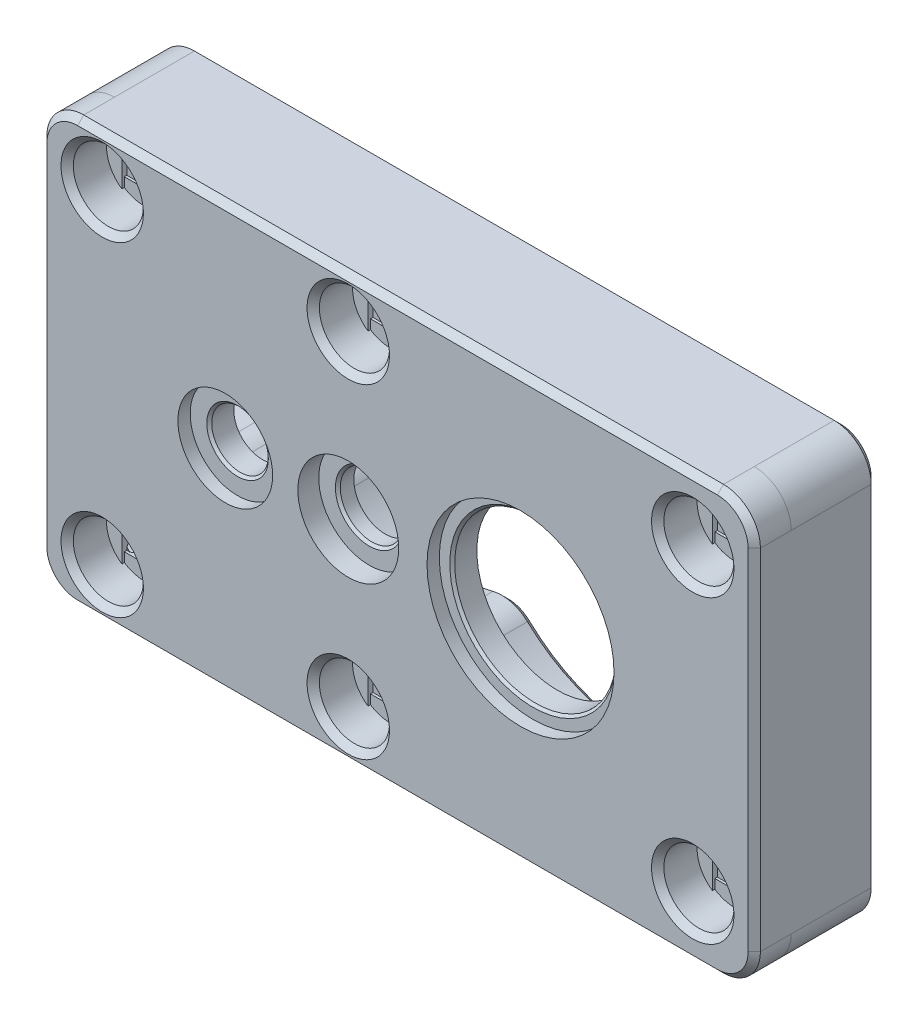
from build123d import *

# Parameters (mm, degrees)
BOSS_EXTRUDE1_DEPTH  = 7
BOSS_EXTRUDE2_DEPTH  = 3
SKETCH4_R            = 2.3
SKETCH4_R_2          = 2.550000000000001
SKETCH4_R_3          = 6.550000000000002
CUT_EXTRUDE1_DEPTH   = 48.37974250668739
SKETCH5_R            = 3.85
CUT_EXTRUDE2_DEPTH   = 1
SKETCH6_R            = 4.1000000000000005
CUT_EXTRUDE3_DEPTH   = 1.7
SKETCH7_R            = 7.6000000000000005
CUT_EXTRUDE4_DEPTH   = 1
FILLET1_R            = 3
CHAMFER1_SIZE        = 0.2
FILLET2_R            = 1
SKETCH8_R            = 1.6000000000000019
SKETCH8_R_2          = 1.6
CUT_EXTRUDE5_DEPTH   = 48.37974252779346
SKETCH9_R            = 2.85
CUT_EXTRUDE6_DEPTH   = 3.2
CUT_EXTRUDE7_START   = -0.2
SKETCH11_R           = 1.6
CUT_EXTRUDE7_DEPTH   = 0.2
SKETCH12_W           = 3.2000000000000046
SKETCH12_H           = 3.1999999999999993
CUT_EXTRUDE8_DEPTH   = 0.2
SKETCH15_R           = 1.5999999999999979
CUT_EXTRUDE9_DEPTH   = 48.37974252779346
CUT_EXTRUDE10_DEPTH  = 3.1
FILLET3_R            = 1
FILLET3_OF_MIRROR1_R = 1
CHAMFER2_SIZE        = 0.5


with BuildPart() as part:
    # Sketch1 → Boss-Extrude1 (new body)
    with BuildSketch(Plane.XY):
        with BuildLine():
            Line((-15, 5.999999999999998), (-15, 14.200000000000005))
            ThreePointArc((-15, 14.200000000000005), (-14.121320343559638, 16.321320343559645), (-12, 17.2))
            Line((-12, 17.2), (40, 17.199999999999992))
            ThreePointArc((40, 17.199999999999992), (42.121320343559645, 16.321320343559634), (43, 14.19999999999999))
            Line((43, 14.19999999999999), (43, -14.199999999999994))
            ThreePointArc((43, -14.199999999999994), (42.12132034355964, -16.321320343559634), (40, -17.199999999999992))
            Line((40, -17.199999999999992), (-12.000000000000004, -17.2))
            ThreePointArc((-12.000000000000004, -17.2), (-14.121320343559644, -16.32132034355964), (-15, -14.200000000000001))
            Line((-15, -14.200000000000001), (-15, -6))
            ThreePointArc((-15, -6), (-14.121320343559642, -3.878679656440357), (-12, -2.9999999999999996))
            Line((-12, -2.9999999999999996), (-3.605551275463993, -2.9999999999999982))
            ThreePointArc((-3.605551275463993, -2.9999999999999982), (-2.803767549726719, -3.1091276650217052), (-2.060315014550853, -3.428571428571429))
            ThreePointArc((-2.060315014550853, -3.428571428571429), (-1.000033178407501, -3.8729747794278495), (0.14285714285714599, -3.997448165609493))
            ThreePointArc((0.14285714285714599, -3.997448165609493), (1.5720317156342603, -4.302537419625869), (2.687500000000003, -5.24665071736246))
            ThreePointArc((2.687500000000003, -5.24665071736246), (6.931902414879214, -8.460896950570664), (12.25, -8.714212528966685))
            ThreePointArc((12.25, -8.714212528966685), (13.750000000000002, -8.714212528966684), (15.062500000000004, -9.440396906380576))
            ThreePointArc((15.062500000000004, -9.440396906380576), (36.99999999999999, 0), (15.062500000000002, 9.440396906380574))
            ThreePointArc((15.062500000000002, 9.440396906380574), (13.75, 8.714212528966684), (12.25, 8.714212528966685))
            ThreePointArc((12.25, 8.714212528966685), (6.931902414879218, 8.460896950570666), (2.687500000000004, 5.246650717362461))
            ThreePointArc((2.687500000000004, 5.246650717362461), (1.5720317156342611, 4.302537419625867), (0.14285714285714596, 3.997448165609493))
            ThreePointArc((0.14285714285714596, 3.997448165609493), (-1.000033178407501, 3.8729747794278495), (-2.060315014550853, 3.428571428571429))
            ThreePointArc((-2.060315014550853, 3.428571428571429), (-2.8037675497267185, 3.109127665021704), (-3.605551275463993, 2.9999999999999982))
            Line((-3.605551275463993, 2.9999999999999982), (-12, 2.9999999999999996))
            ThreePointArc((-12, 2.9999999999999996), (-14.121320343559642, 3.878679656440356), (-15, 5.999999999999998))
        make_face()
    extrude(amount=BOSS_EXTRUDE1_DEPTH)

    # Sketch2 → Boss-Extrude2 (add)
    with BuildSketch(Plane.XY.offset(7.000000000000002)):
        Polygon((-15, 17.2), (43, 17.2), (43, -17.199999999999992), (-14.999999999999996, -17.199999999999992), align=None)
    extrude(amount=BOSS_EXTRUDE2_DEPTH)

    # Sketch4 → Cut-Extrude1 (cut, through all)
    with BuildSketch(Plane.XY.offset(10.000000000000002)):
        Circle(SKETCH4_R)
        with Locations((10, 0)):
            Circle(SKETCH4_R_2)
        with Locations((24, 0)):
            Circle(SKETCH4_R_3)
    extrude(amount=-CUT_EXTRUDE1_DEPTH, mode=Mode.SUBTRACT)

    # Sketch5 → Cut-Extrude2 (cut)
    with BuildSketch(Plane.XY.offset(10.000000000000002)):
        Circle(SKETCH5_R)
    extrude(amount=-CUT_EXTRUDE2_DEPTH, mode=Mode.SUBTRACT)

    # Sketch6 → Cut-Extrude3 (cut)
    with BuildSketch(Plane.XY.offset(10.000000000000002)):
        with Locations((10.000000000000002, 0)):
            Circle(SKETCH6_R)
    extrude(amount=-CUT_EXTRUDE3_DEPTH, mode=Mode.SUBTRACT)

    # Sketch7 → Cut-Extrude4 (cut)
    with BuildSketch(Plane.XY.offset(10.000000000000002)):
        with Locations((24, 0)):
            Circle(SKETCH7_R)
    extrude(amount=-CUT_EXTRUDE4_DEPTH, mode=Mode.SUBTRACT)

    # Fillet1
    fillet1_edges = [part.edges().sort_by_distance(p)[0] for p in [
        (43, -17.199999999999992, 8.500000000000002),
        (-14.999999999999996, -17.199999999999992, 8.500000000000002),
        (-15, 17.2, 8.500000000000002),
        (43, 17.2, 8.500000000000002),
    ]]
    fillet(fillet1_edges, radius=FILLET1_R)

    # Chamfer1
    chamfer1_edges = [part.edges().sort_by_distance(p)[0] for p in [
        (-2.3, 2.8e-16, 9.000000000000002),
        (7.449999999999999, -8.2e-16, 8.300000000000002),
        (17.45, 8e-16, 9.000000000000002),
    ]]
    chamfer(chamfer1_edges, length=CHAMFER1_SIZE)

    # Fillet2
    fillet2_edges = [part.edges().sort_by_distance(p)[0] for p in [
        (13.75, 8.714212528966684, 7),
        (6.931902414879217, 8.460896950570664, 7),
        (1.5720317156342616, 4.302537419625867, 7),
        (-1.0000331784075014, 3.8729747794278495, 7),
        (-2.803767549726719, 3.1091276650217043, 7),
        (-7.802775637731997, 2.999999999999999, 7),
        (-14.121320343559642, 3.878679656440356, 7),
        (-14.121320343559642, -3.878679656440358, 7),
        (-7.802775637731997, -2.999999999999999, 7),
        (-2.8037675497267194, -3.1091276650217052, 7),
        (-1.0000331784075012, -3.8729747794278495, 7),
        (1.5720317156342603, -4.302537419625869, 7),
        (6.931902414879216, -8.460896950570664, 7),
        (13.750000000000002, -8.714212528966684, 7),
        (36.99999999999999, 1.377e-14, 7),
    ]]
    fillet(fillet2_edges, radius=FILLET2_R)

    # Sketch8 → Cut-Extrude5 (cut, through all)
    with BuildSketch(Plane(origin=(0, 0, 0), x_dir=(-1, 0, 0), z_dir=(0, 0, -1))):
        with Locations((-9.999999999999996, -13.199999999999994)):
            Circle(SKETCH8_R)
        with Locations((10.000000000000004, -13.199999999999994)):
            Circle(SKETCH8_R_2)
        with Locations((-9.999999999999996, 13.200000000000005)):
            Circle(SKETCH8_R_2)
        with Locations((10.000000000000004, 13.200000000000005)):
            Circle(SKETCH8_R_2)
    extrude(amount=-CUT_EXTRUDE5_DEPTH, mode=Mode.SUBTRACT)

    # Sketch9 → Cut-Extrude6 (cut)
    with BuildSketch(Plane.XY.offset(10.000000000000002)):
        with Locations((-10.000000000000004, 13.200000000000005)):
            Circle(SKETCH9_R)
    cut_extrude6 = extrude(amount=-CUT_EXTRUDE6_DEPTH, mode=Mode.SUBTRACT)

    # Sketch11 → Cut-Extrude7 (cut)
    with BuildSketch(Plane.XY.offset(6.8000000000000025).offset(CUT_EXTRUDE7_START)):
        with BuildLine():
            ThreePointArc((-8.400000000000002, 15.558495283014155), (-10.000000000000004, 16.050000000000004), (-11.600000000000005, 15.558495283014155))
            Line((-11.600000000000005, 15.558495283014155), (-11.600000000000005, 13.200000000000003))
            ThreePointArc((-11.600000000000003, 13.200000000000005), (-10.000000000000004, 14.800000000000004), (-8.400000000000004, 13.200000000000005))
            Line((-8.400000000000002, 13.200000000000005), (-8.400000000000002, 15.558495283014155))
        make_face()
        with BuildLine():
            ThreePointArc((-8.400000000000004, 13.200000000000005), (-10.000000000000004, 11.600000000000005), (-11.600000000000003, 13.200000000000005))
            Line((-11.600000000000005, 13.200000000000003), (-11.600000000000005, 10.841504716985854))
            ThreePointArc((-11.600000000000007, 10.841504716985856), (-10.000000000000004, 10.350000000000005), (-8.400000000000004, 10.841504716985854))
            Line((-8.400000000000002, 10.841504716985854), (-8.400000000000002, 13.200000000000005))
        make_face()
        with Locations(Location((-10.000000000000004, 13.200000000000005, 0), (0, 0, 180))):
            Circle(SKETCH11_R)
    cut_extrude7 = extrude(amount=CUT_EXTRUDE7_DEPTH, mode=Mode.SUBTRACT)

    # Sketch12 → Cut-Extrude8 (cut)
    with BuildSketch(Plane.XY.offset(6.600000000000002)):
        with Locations((-10.000000000000004, 13.200000000000006)):
            Rectangle(SKETCH12_W, SKETCH12_H)
    cut_extrude8 = extrude(amount=-CUT_EXTRUDE8_DEPTH, mode=Mode.SUBTRACT)

    # Sketch-Pattern1: Cut-Extrude6, Cut-Extrude7, Cut-Extrude8 at 3 more places
    with Locations((20, 0, 0), (20, -26.4, 0), (0, -26.4, 0)):
        add(cut_extrude6, mode=Mode.SUBTRACT)
        add(cut_extrude7, mode=Mode.SUBTRACT)
        add(cut_extrude8, mode=Mode.SUBTRACT)

    # Sketch15 → Cut-Extrude9 (cut, through all)
    with BuildSketch(Plane.XY.offset(10.000000000000002)):
        with Locations((38.00000000000001, 12.199999999999992)):
            Circle(SKETCH15_R)
        with Locations((38.00000000000001, -12.199999999999992)):
            Circle(SKETCH15_R)
    extrude(amount=-CUT_EXTRUDE9_DEPTH, mode=Mode.SUBTRACT)

    # Sketch-Pattern3: Cut-Extrude6, Cut-Extrude7, Cut-Extrude8 at 2 more places
    with Locations((48, -1, 0), (48, -25.4, 0)):
        add(cut_extrude6, mode=Mode.SUBTRACT)
        add(cut_extrude7, mode=Mode.SUBTRACT)
        add(cut_extrude8, mode=Mode.SUBTRACT)

    # Sketch16 → Cut-Extrude10 (cut)
    with BuildSketch(Plane(origin=(0, 0, 0), x_dir=(-1, 0, 0), z_dir=(0, 0, -1))):
        with BuildLine():
            Line((3.9999999999999925, -7.6000000000000005), (2.4142135623731473, -7.6000000000000005))
            ThreePointArc((2.4142135623731473, -7.6000000000000005), (1.9932617867715514, -7.683732514237584), (1.6363961030679497, -7.922182540694794))
            Line((1.6363961030679497, -7.922182540694794), (-1.3636038969320825, -10.922182540694791))
            ThreePointArc((-1.3636038969320825, -10.922182540694791), (-1.6020539233893005, -12.120951775601595), (-0.5857864376268844, -12.799999999999999))
            Line((-0.5857864376268844, -12.799999999999999), (3.9999999999999933, -12.799999999999999))
            ThreePointArc((3.9999999999999933, -12.799999999999999), (4.7778174593052, -12.477817459305202), (5.099999999999999, -11.699999999999994))
            Line((5.099999999999999, -11.699999999999994), (5.1, -8.700000000000008))
            ThreePointArc((5.1, -8.700000000000008), (4.777817459305202, -7.9221825406947985), (3.9999999999999925, -7.6000000000000005))
        make_face()
    cut_extrude10 = extrude(amount=-CUT_EXTRUDE10_DEPTH, mode=Mode.SUBTRACT)

    # Fillet3
    fillet3_edges = [part.edges().sort_by_distance(p)[0] for p in [
        (-4.777817459305202, -7.9221825406947985, 3.1),
        (-5.1, -10.200000000000001, 3.1),
        (-4.777817459305201, -12.4778174593052, 3.1),
        (-1.7071067811865543, -12.799999999999999, 3.1),
        (1.602053923389301, -12.120951775601595, 3.1),
        (-0.1363961030679337, -9.422182540694793, 3.1),
        (-1.9932617867715514, -7.683732514237584, 3.1),
        (-3.20710678118657, -7.6000000000000005, 3.1),
        (-4.777817459305202, -7.9221825406947985, 0),
        (-3.20710678118657, -7.6000000000000005, 0),
        (-1.9932617867715514, -7.683732514237584, 0),
        (-0.1363961030679337, -9.422182540694793, 0),
        (1.602053923389301, -12.120951775601595, 0),
        (-1.7071067811865543, -12.799999999999999, 0),
        (-4.777817459305201, -12.4778174593052, 0),
        (-5.1, -10.200000000000001, 0),
    ]]
    fillet(fillet3_edges, radius=FILLET3_R)

    # Mirror1: Cut-Extrude10 across plane
    add(cut_extrude10.mirror(Plane.ZX), mode=Mode.SUBTRACT)

    # Fillet3 of Mirror1
    fillet3_of_mirror1_edges = [part.edges().sort_by_distance(p)[0] for p in [
        (-4.777817459305202, 7.9221825406947985, 3.1),
        (-5.1, 10.200000000000001, 3.1),
        (-4.777817459305201, 12.4778174593052, 3.1),
        (-1.7071067811865543, 12.799999999999999, 3.1),
        (1.602053923389301, 12.120951775601595, 3.1),
        (-0.1363961030679337, 9.422182540694793, 3.1),
        (-1.9932617867715514, 7.683732514237584, 3.1),
        (-3.20710678118657, 7.6000000000000005, 3.1),
        (-4.777817459305202, 7.9221825406947985, 0),
        (-3.20710678118657, 7.6000000000000005, 0),
        (-1.9932617867715514, 7.683732514237584, 0),
        (-0.1363961030679337, 9.422182540694793, 0),
        (1.602053923389301, 12.120951775601595, 0),
        (-1.7071067811865543, 12.799999999999999, 0),
        (-4.777817459305201, 12.4778174593052, 0),
        (-5.1, 10.200000000000001, 0),
    ]]
    fillet(fillet3_of_mirror1_edges, radius=FILLET3_OF_MIRROR1_R)

    # Chamfer2
    # the kernel refuses this chamfer: 0.5 mm, written as the material it takes off along each edge
    with BuildSketch(Plane(origin=(43, 14.2, 10.000000000000002), x_dir=(0.0274958766105822, 0, -0.999621916911297), z_dir=(0, -1, 0))) as chamfer2_piece_1:
        Polygon((CHAMFER2_SIZE * 0.999621916911, -CHAMFER2_SIZE * 0.0274958766106), (-CHAMFER2_SIZE * 0.0274958766106, -CHAMFER2_SIZE * 0.999621916911), (0, 0), align=None)
    extrude(amount=28.39999999999999, mode=Mode.SUBTRACT)
    with BuildSketch(Plane(origin=(40, -17.199999999999992, 10.000000000000002), x_dir=(0, -0.0274958766105891, -0.9996219169112968), z_dir=(-1, 0, 0)), Plane(origin=(-12.000000000000002, 17.2, 10.000000000000002), x_dir=(0, 0.0274958766105891, -0.9996219169112968), z_dir=(1, 0, 0))) as chamfer2_piece_2:
        Polygon((CHAMFER2_SIZE * 0.999621916911, -CHAMFER2_SIZE * 0.0274958766106), (-CHAMFER2_SIZE * 0.0274958766106, -CHAMFER2_SIZE * 0.999621916911), (0, 0), align=None)
    extrude(amount=52, mode=Mode.SUBTRACT)
    with BuildSketch(Plane(origin=(-14.999999999999996, -14.199999999999992, 10.000000000000002), x_dir=(-0.027495876610585647, 0, -0.9996219169112968), z_dir=(-1e-16, 1, 0))) as chamfer2_piece_3:
        Polygon((CHAMFER2_SIZE * 0.999621916911, -CHAMFER2_SIZE * 0.0274958766106), (-CHAMFER2_SIZE * 0.0274958766106, -CHAMFER2_SIZE * 0.999621916911), (0, 0), align=None)
    extrude(amount=28.39999999999999, mode=Mode.SUBTRACT)
    with BuildSketch(Plane(origin=(40, 14.2, 10.000000000000002), x_dir=(0, 1, 0), z_dir=(-1, 0, 0))) as chamfer2_piece_4:
        Polygon((3 - CHAMFER2_SIZE, 0), (3, CHAMFER2_SIZE), (3, 0), align=None)
    revolve(axis=Axis((40, 14.2, 10.000000000000002), (0, 0, -1)), revolution_arc=90, mode=Mode.SUBTRACT)
    with BuildSketch(Plane(origin=(-12, 14.2, 10.000000000000002), x_dir=(0, 1, 0), z_dir=(1, 0, 0))) as chamfer2_piece_5:
        Polygon((3 - CHAMFER2_SIZE, 0), (3, -CHAMFER2_SIZE), (3, 0), align=None)
    revolve(axis=Axis((-12, 14.2, 10.000000000000002), (0, 0, 1)), revolution_arc=90, mode=Mode.SUBTRACT)
    with BuildSketch(Plane(origin=(-11.999999999999998, -14.199999999999992, 10.000000000000002), x_dir=(-1, 0, 0), z_dir=(0, 1, 0))) as chamfer2_piece_6:
        Polygon((3, -CHAMFER2_SIZE), (3 - CHAMFER2_SIZE, 0), (3, 0), align=None)
    revolve(axis=Axis((-11.999999999999998, -14.199999999999992, 10.000000000000002), (0, 0, 1)), revolution_arc=90, mode=Mode.SUBTRACT)
    with BuildSketch(Plane(origin=(40, -14.199999999999992, 10.000000000000002), x_dir=(1, 0, 0), z_dir=(0, 1, 0))) as chamfer2_piece_7:
        Polygon((3 - CHAMFER2_SIZE, 0), (3, CHAMFER2_SIZE), (3, 0), align=None)
    revolve(axis=Axis((40, -14.199999999999992, 10.000000000000002), (0, 0, -1)), revolution_arc=90, mode=Mode.SUBTRACT)
    with BuildSketch(Plane(origin=(-3.605551275463993, 5.999999999999994, 0), x_dir=(0.5150787536377142, -0.8571428571428564, 0), z_dir=(0.8571428571428564, 0.5150787536377142, 0))) as chamfer2_piece_8:
        Polygon((2.9999999999999956 - CHAMFER2_SIZE, 0), (2.9999999999999956, -CHAMFER2_SIZE), (2.9999999999999956, 0), align=None)
    revolve(axis=Axis((-3.605551275463993, 5.999999999999994, 0), (0, 0, -1)), revolution_arc=31.00271913387408, mode=Mode.SUBTRACT)
    with BuildSketch(Plane(origin=(-3.605551275463993, 2.9999999999999982, 0), x_dir=(0, 0.9996219169112968, -0.027495876610586365), z_dir=(-1, 1.6e-16, 0)), Plane(origin=(-12, -2.9999999999999996, 0), x_dir=(0, -0.9996219169112968, -0.027495876610586365), z_dir=(1, 1.6e-16, 0))) as chamfer2_piece_9:
        Polygon((CHAMFER2_SIZE * 0.999621916911, -CHAMFER2_SIZE * 0.0274958766106), (-CHAMFER2_SIZE * 0.0274958766106, -CHAMFER2_SIZE * 0.999621916911), (0, 0), align=None)
    extrude(amount=8.394448724536007, mode=Mode.SUBTRACT)
    with BuildSketch(Plane(origin=(-10.000000000000004, -13.199999999999994, 0), x_dir=(-1, 0, 0), z_dir=(0, -1, 0))) as chamfer2_piece_10:
        Polygon((1.5999999999999996 + CHAMFER2_SIZE, 0), (1.5999999999999996, -CHAMFER2_SIZE), (1.5999999999999996, 0), align=None)
    revolve(axis=Axis((-10.000000000000004, -13.199999999999994, 0), (0, 0, -1)), mode=Mode.SUBTRACT)
    with BuildSketch(Plane(origin=(-12, 5.999999999999998, 0), x_dir=(0, -1, 0), z_dir=(1, 0, 0))) as chamfer2_piece_11:
        Polygon((2.9999999999999996 - CHAMFER2_SIZE, 0), (2.9999999999999996, -CHAMFER2_SIZE), (2.9999999999999996, 0), align=None)
    revolve(axis=Axis((-12, 5.999999999999998, 0), (0, 0, -1)), revolution_arc=90, mode=Mode.SUBTRACT)
    with BuildSketch(Plane(origin=(9.999999999999996, 13.200000000000005, 0), x_dir=(-1, 0, 0), z_dir=(0, -1, 0))) as chamfer2_piece_12:
        Polygon((1.5999999999999996 + CHAMFER2_SIZE, 0), (1.5999999999999996, -CHAMFER2_SIZE), (1.5999999999999996, 0), align=None)
    revolve(axis=Axis((9.999999999999996, 13.200000000000005, 0), (0, 0, -1)), mode=Mode.SUBTRACT)
    with BuildSketch(Plane(origin=(-10.000000000000004, 13.200000000000005, 0), x_dir=(-1, 0, 0), z_dir=(0, -1, 0))) as chamfer2_piece_13:
        Polygon((1.5999999999999996 + CHAMFER2_SIZE, 0), (1.5999999999999996, -CHAMFER2_SIZE), (1.5999999999999996, 0), align=None)
    revolve(axis=Axis((-10.000000000000004, 13.200000000000005, 0), (0, 0, -1)), mode=Mode.SUBTRACT)
    with BuildSketch(Plane(origin=(9.999999999999996, -13.199999999999994, 0), x_dir=(-1, 0, 0), z_dir=(0, -1, 0))) as chamfer2_piece_14:
        Polygon((1.6000000000000014 + CHAMFER2_SIZE, 0), (1.6000000000000014, -CHAMFER2_SIZE), (1.6000000000000014, 0), align=None)
    revolve(axis=Axis((9.999999999999996, -13.199999999999994, 0), (0, 0, -1)), mode=Mode.SUBTRACT)
    with BuildSketch(Plane(origin=(-15, 5.999999999999998, 0), x_dir=(0.9996219169112968, 0, -0.02749587661058644), z_dir=(0, 1, 0))) as chamfer2_piece_15:
        Polygon((CHAMFER2_SIZE * 0.999621916911, -CHAMFER2_SIZE * 0.0274958766106), (-CHAMFER2_SIZE * 0.0274958766106, -CHAMFER2_SIZE * 0.999621916911), (0, 0), align=None)
    extrude(amount=8.200000000000006, mode=Mode.SUBTRACT)
    with BuildSketch(Plane(origin=(-11.999999999999996, 14.199999999999998, 0), x_dir=(-1, 2.37e-15, 0), z_dir=(-2.37e-15, -1, 0))) as chamfer2_piece_16:
        Polygon((3.0000000000000036 - CHAMFER2_SIZE, 0), (3.0000000000000036, -CHAMFER2_SIZE), (3.0000000000000036, 0), align=None)
    revolve(axis=Axis((-11.999999999999996, 14.199999999999998, 0), (0, 0, -1)), revolution_arc=89.9999999999998, mode=Mode.SUBTRACT)
    with BuildSketch(Plane(origin=(-10.000000000000004, 13.200000000000005, 10.000000000000002), x_dir=(1, 0, 0), z_dir=(0, -1, 0))) as chamfer2_piece_17:
        Polygon((2.8499999999999996 + CHAMFER2_SIZE, 0), (2.8499999999999996, -CHAMFER2_SIZE), (2.8499999999999996, 0), align=None)
    revolve(axis=Axis((-10.000000000000004, 13.200000000000005, 10.000000000000002), (0, 0, 1)), mode=Mode.SUBTRACT)
    with BuildSketch(Plane(origin=(-12, 17.2, 0), x_dir=(0, -0.9996219169112968, -0.027495876610586292), z_dir=(1, -1.4e-16, 0)), Plane(origin=(40, -17.199999999999992, 0), x_dir=(0, 0.9996219169112968, -0.027495876610586292), z_dir=(-1, -1.4e-16, 0))) as chamfer2_piece_18:
        Polygon((CHAMFER2_SIZE * 0.999621916911, -CHAMFER2_SIZE * 0.0274958766106), (-CHAMFER2_SIZE * 0.0274958766106, -CHAMFER2_SIZE * 0.999621916911), (0, 0), align=None)
    extrude(amount=52, mode=Mode.SUBTRACT)
    with BuildSketch(Plane(origin=(40.00000000000001, 14.199999999999996, 0), x_dir=(-2.37e-15, 1, 0), z_dir=(-1, -2.37e-15, 0))) as chamfer2_piece_19:
        Polygon((2.999999999999993 - CHAMFER2_SIZE, 0), (2.999999999999993, -CHAMFER2_SIZE), (2.999999999999993, 0), align=None)
    revolve(axis=Axis((40.00000000000001, 14.199999999999996, 0), (0, 0, -1)), revolution_arc=90.00000000000024, mode=Mode.SUBTRACT)
    with BuildSketch(Plane(origin=(43, 14.19999999999999, 0), x_dir=(-0.9996219169112968, 0, -0.027495876610586483), z_dir=(0, -1, 0))) as chamfer2_piece_20:
        Polygon((CHAMFER2_SIZE * 0.999621916911, -CHAMFER2_SIZE * 0.0274958766106), (-CHAMFER2_SIZE * 0.0274958766106, -CHAMFER2_SIZE * 0.999621916911), (0, 0), align=None)
    extrude(amount=28.399999999999984, mode=Mode.SUBTRACT)
    with BuildSketch(Plane(origin=(39.999999999999986, -14.199999999999985, 0), x_dir=(1, -2.96e-15, 0), z_dir=(2.96e-15, 1, 0))) as chamfer2_piece_21:
        Polygon((3.000000000000014 - CHAMFER2_SIZE, 0), (3.000000000000014, -CHAMFER2_SIZE), (3.000000000000014, 0), align=None)
    revolve(axis=Axis((39.999999999999986, -14.199999999999985, 0), (0, 0, -1)), revolution_arc=89.99999999999957, mode=Mode.SUBTRACT)
    with BuildSketch(Plane(origin=(-12, -14.2, 0), x_dir=(-1.18e-15, -1, 0), z_dir=(1, -1.18e-15, 0))) as chamfer2_piece_22:
        Polygon((3 - CHAMFER2_SIZE, 0), (3, -CHAMFER2_SIZE), (3, 0), align=None)
    revolve(axis=Axis((-12, -14.2, 0), (0, 0, -1)), revolution_arc=89.9999999999999, mode=Mode.SUBTRACT)
    with BuildSketch(Plane(origin=(-11.999999999999996, -6.000000000000002, 0), x_dir=(-1, 5.9e-16, 0), z_dir=(-5.9e-16, -1, 0))) as chamfer2_piece_23:
        Polygon((3.0000000000000036 - CHAMFER2_SIZE, 0), (3.0000000000000036, -CHAMFER2_SIZE), (3.0000000000000036, 0), align=None)
    revolve(axis=Axis((-11.999999999999996, -6.000000000000002, 0), (0, 0, -1)), revolution_arc=89.9999999999999, mode=Mode.SUBTRACT)
    with BuildSketch(Plane(origin=(-3.605551275464003, -6.000000000000027, 0), x_dir=(3.26e-15, 1, 0), z_dir=(-1, 3.26e-15, 0))) as chamfer2_piece_24:
        Polygon((3.0000000000000284 - CHAMFER2_SIZE, 0), (3.0000000000000284, -CHAMFER2_SIZE), (3.0000000000000284, 0), align=None)
    revolve(axis=Axis((-3.605551275464003, -6.000000000000027, 0), (0, 0, -1)), revolution_arc=31.002719133873725, mode=Mode.SUBTRACT)
    with BuildSketch(Plane(origin=(2.47e-15, 1.088e-14, 0), x_dir=(-0.5150787536377125, -0.8571428571428574, 0), z_dir=(-0.8571428571428574, 0.5150787536377125, 0))) as chamfer2_piece_25:
        Polygon((4.000000000000012 + CHAMFER2_SIZE, 0), (4.000000000000012, CHAMFER2_SIZE), (4.000000000000012, 0), align=None)
    revolve(axis=Axis((2.47e-15, 1.088e-14, 0), (0, 0, 1)), revolution_arc=33.049432231546554, mode=Mode.SUBTRACT)
    with BuildSketch(Plane(origin=(0.249999999999999, -6.99553428981662, 0), x_dir=(-0.03571428571428425, 0.9993620414023731, 0), z_dir=(-0.9993620414023731, -0.03571428571428425, 0))) as chamfer2_piece_26:
        Polygon((3.000000000000007 - CHAMFER2_SIZE, 0), (3.000000000000007, -CHAMFER2_SIZE), (3.000000000000007, 0), align=None)
    revolve(axis=Axis((0.249999999999999, -6.99553428981662, 0), (0, 0, -1)), revolution_arc=56.38762540153368, mode=Mode.SUBTRACT)
    with BuildSketch(Plane(origin=(10, 2.66e-15, 0), x_dir=(-0.8124999999999997, -0.5829611908180515, 0), z_dir=(-0.5829611908180515, 0.8124999999999997, 0))) as chamfer2_piece_27:
        Polygon((9.000000000000002 + CHAMFER2_SIZE, 0), (9.000000000000002, CHAMFER2_SIZE), (9.000000000000002, 0), align=None)
    revolve(axis=Axis((10, 2.66e-15, 0), (0, 0, 1)), revolution_arc=68.81842448979113, mode=Mode.SUBTRACT)
    with BuildSketch(Plane(origin=(-10.000000000000004, -13.199999999999994, 6.400000000000002), x_dir=(-1, 0, 0), z_dir=(0, -1, 0))) as chamfer2_piece_28_section:
        Polygon((1.5999999999999996, CHAMFER2_SIZE), (1.5999999999999996 + CHAMFER2_SIZE, 0), (1.5999999999999996, 0), align=None)
    chamfer2_piece_28 = revolve(axis=Axis((-10.000000000000004, -13.199999999999994, 6.400000000000002), (0, 0, -1)), revolution_arc=90, mode=Mode.PRIVATE)
    chamfer2_piece_28 = split(chamfer2_piece_28, bisect_by=Plane(origin=(-11.600000000000005, -12.021446695962746, 6.213135176030215), z_dir=(1, 0, 0)), keep=Keep.TOP, mode=Mode.PRIVATE)
    chamfer2_piece_28 = split(chamfer2_piece_28, bisect_by=Plane(origin=(-11.178553304037255, -11.599999999999993, 6.213135176030215), z_dir=(0, -1, 0)), keep=Keep.TOP, mode=Mode.PRIVATE)
    add(chamfer2_piece_28, mode=Mode.SUBTRACT)
    with BuildSketch(Plane(origin=(-10.000000000000004, -13.199999999999994, 6.400000000000002), x_dir=(0, 1, 0), z_dir=(-1, 0, 0))) as chamfer2_piece_29_section:
        Polygon((1.5999999999999996, CHAMFER2_SIZE), (1.5999999999999996 + CHAMFER2_SIZE, 0), (1.5999999999999996, 0), align=None)
    chamfer2_piece_29 = revolve(axis=Axis((-10.000000000000004, -13.199999999999994, 6.400000000000002), (0, 0, -1)), revolution_arc=90, mode=Mode.PRIVATE)
    chamfer2_piece_29 = split(chamfer2_piece_29, bisect_by=Plane(origin=(-8.400000000000002, -12.021446695962743, 6.213135176030216), z_dir=(-1, 0, 0)), keep=Keep.TOP, mode=Mode.PRIVATE)
    chamfer2_piece_29 = split(chamfer2_piece_29, bisect_by=Plane(origin=(-8.82144669596276, -11.599999999999993, 6.213135176030216), z_dir=(0, -1, 0)), keep=Keep.TOP, mode=Mode.PRIVATE)
    add(chamfer2_piece_29, mode=Mode.SUBTRACT)
    with BuildSketch(Plane(origin=(-10.000000000000004, -13.199999999999994, 6.400000000000002), x_dir=(1, 0, 0), z_dir=(0, 1, 0))) as chamfer2_piece_30_section:
        Polygon((1.5999999999999996, CHAMFER2_SIZE), (1.5999999999999996 + CHAMFER2_SIZE, 0), (1.5999999999999996, 0), align=None)
    chamfer2_piece_30 = revolve(axis=Axis((-10.000000000000004, -13.199999999999994, 6.400000000000002), (0, 0, -1)), revolution_arc=90, mode=Mode.PRIVATE)
    chamfer2_piece_30 = split(chamfer2_piece_30, bisect_by=Plane(origin=(-8.821446695962745, -14.799999999999994, 6.213135176030212), z_dir=(0, 1, 0)), keep=Keep.TOP, mode=Mode.PRIVATE)
    chamfer2_piece_30 = split(chamfer2_piece_30, bisect_by=Plane(origin=(-8.400000000000002, -14.378553304037236, 6.213135176030212), z_dir=(-1, 0, 0)), keep=Keep.TOP, mode=Mode.PRIVATE)
    add(chamfer2_piece_30, mode=Mode.SUBTRACT)
    with BuildSketch(Plane(origin=(-10.000000000000004, -13.199999999999994, 6.400000000000002), x_dir=(0, -1, 0), z_dir=(1, 0, 0))) as chamfer2_piece_31_section:
        Polygon((1.5999999999999996, CHAMFER2_SIZE), (1.5999999999999996 + CHAMFER2_SIZE, 0), (1.5999999999999996, 0), align=None)
    chamfer2_piece_31 = revolve(axis=Axis((-10.000000000000004, -13.199999999999994, 6.400000000000002), (0, 0, -1)), revolution_arc=90, mode=Mode.PRIVATE)
    chamfer2_piece_31 = split(chamfer2_piece_31, bisect_by=Plane(origin=(-11.600000000000005, -14.378553304037249, 6.213135176030218), z_dir=(1, 0, 0)), keep=Keep.TOP, mode=Mode.PRIVATE)
    chamfer2_piece_31 = split(chamfer2_piece_31, bisect_by=Plane(origin=(-11.178553304037255, -14.799999999999994, 6.213135176030218), z_dir=(0, 1, 0)), keep=Keep.TOP, mode=Mode.PRIVATE)
    add(chamfer2_piece_31, mode=Mode.SUBTRACT)
    with BuildSketch(Plane(origin=(13.000000000000004, -11.618950038622248, 0), x_dir=(-0.25000000000000105, 0.9682458365518539, 0), z_dir=(-0.9682458365518539, -0.25000000000000105, 0))) as chamfer2_piece_32:
        Polygon((3.0000000000000013 - CHAMFER2_SIZE, 0), (3.0000000000000013, -CHAMFER2_SIZE), (3.0000000000000013, 0), align=None)
    revolve(axis=Axis((13.000000000000004, -11.618950038622248, 0), (0, 0, -1)), revolution_arc=57.91004874371975, mode=Mode.SUBTRACT)
    with BuildSketch(Plane(origin=(24, 7.55e-15, 0), x_dir=(-0.6874999999999997, -0.7261843774138909, 0), z_dir=(-0.7261843774138909, 0.6874999999999997, 0))) as chamfer2_piece_33:
        Polygon((12.999999999999995 + CHAMFER2_SIZE, 0), (12.999999999999995, CHAMFER2_SIZE), (12.999999999999995, 0), align=None)
    revolve(axis=Axis((24, 7.55e-15, 0), (0, 0, 1)), revolution_arc=266.86507311557955, mode=Mode.SUBTRACT)
    with BuildSketch(Plane(origin=(-10.000000000000004, -13.199999999999994, 10.000000000000002), x_dir=(1, 0, 0), z_dir=(0, -1, 0))) as chamfer2_piece_34:
        Polygon((2.8499999999999996 + CHAMFER2_SIZE, 0), (2.8499999999999996, -CHAMFER2_SIZE), (2.8499999999999996, 0), align=None)
    revolve(axis=Axis((-10.000000000000004, -13.199999999999994, 10.000000000000002), (0, 0, 1)), mode=Mode.SUBTRACT)
    with BuildSketch(Plane(origin=(13.000000000000004, 11.618950038622247, 0), x_dir=(0.6874999999999996, -0.726184377413891, 0), z_dir=(0.726184377413891, 0.6874999999999996, 0))) as chamfer2_piece_35:
        Polygon((2.999999999999999 - CHAMFER2_SIZE, 0), (3.0000000000000004, -CHAMFER2_SIZE), (2.999999999999999, 0), align=None)
    revolve(axis=Axis((13.000000000000004, 11.618950038622247, 0), (0, 0, -1)), revolution_arc=57.910048743719734, mode=Mode.SUBTRACT)
    with BuildSketch(Plane(origin=(10.000000000000002, -4.88e-15, 0), x_dir=(0.24999999999999975, 0.9682458365518544, 0), z_dir=(0.9682458365518544, -0.24999999999999975, 0))) as chamfer2_piece_36:
        Polygon((9.000000000000004 + CHAMFER2_SIZE, 0), (9.000000000000004, CHAMFER2_SIZE), (9.000000000000004, 0), align=None)
    revolve(axis=Axis((10.000000000000002, -4.88e-15, 0), (0, 0, 1)), revolution_arc=68.8184244897911, mode=Mode.SUBTRACT)
    with BuildSketch(Plane(origin=(0.2500000000000092, 6.995534289816599, 0), x_dir=(0.8125000000000017, -0.5829611908180486, 0), z_dir=(0.5829611908180486, 0.8125000000000017, 0))) as chamfer2_piece_37:
        Polygon((2.9999999999999876 - CHAMFER2_SIZE, 0), (2.9999999999999876, -CHAMFER2_SIZE), (2.9999999999999876, 0), align=None)
    revolve(axis=Axis((0.2500000000000092, 6.995534289816599, 0), (0, 0, -1)), revolution_arc=56.3876254015341, mode=Mode.SUBTRACT)
    with BuildSketch(Plane(origin=(9.999999999999996, -13.199999999999994, 10.000000000000002), x_dir=(1, 0, 0), z_dir=(0, -1, 0))) as chamfer2_piece_38:
        Polygon((2.8499999999999996 + CHAMFER2_SIZE, 0), (2.8499999999999996, -CHAMFER2_SIZE), (2.8499999999999996, 0), align=None)
    revolve(axis=Axis((9.999999999999996, -13.199999999999994, 10.000000000000002), (0, 0, 1)), mode=Mode.SUBTRACT)
    with BuildSketch(Plane(origin=(-2.08e-15, 6.44e-15, 0), x_dir=(0.03571428571428706, 0.9993620414023731, 0), z_dir=(0.9993620414023731, -0.03571428571428706, 0))) as chamfer2_piece_39:
        Polygon((3.9999999999999947 + CHAMFER2_SIZE, 0), (3.9999999999999947, CHAMFER2_SIZE), (3.9999999999999947, 0), align=None)
    revolve(axis=Axis((-2.08e-15, 6.44e-15, 0), (0, 0, 1)), revolution_arc=33.049432231546696, mode=Mode.SUBTRACT)
    with BuildSketch(Plane(origin=(9.999999999999996, 13.200000000000005, 10.000000000000002), x_dir=(1, 0, 0), z_dir=(0, -1, 0))) as chamfer2_piece_40:
        Polygon((2.8499999999999996 + CHAMFER2_SIZE, 0), (2.8499999999999996, -CHAMFER2_SIZE), (2.8499999999999996, 0), align=None)
    revolve(axis=Axis((9.999999999999996, 13.200000000000005, 10.000000000000002), (0, 0, 1)), mode=Mode.SUBTRACT)
    with BuildSketch(Plane(origin=(38.00000000000001, -12.199999999999992, 0), x_dir=(1, 0, 0), z_dir=(0, -1, 0))) as chamfer2_piece_41:
        Polygon((1.6000000000000014 + CHAMFER2_SIZE, 0), (1.6000000000000014, CHAMFER2_SIZE), (1.6000000000000014, 0), align=None)
    revolve(axis=Axis((38.00000000000001, -12.199999999999992, 0), (0, 0, 1)), mode=Mode.SUBTRACT)
    with BuildSketch(Plane(origin=(38.00000000000001, 12.199999999999992, 0), x_dir=(1, 0, 0), z_dir=(0, -1, 0))) as chamfer2_piece_42:
        Polygon((1.6000000000000014 + CHAMFER2_SIZE, 0), (1.6000000000000014, CHAMFER2_SIZE), (1.6000000000000014, 0), align=None)
    revolve(axis=Axis((38.00000000000001, 12.199999999999992, 0), (0, 0, 1)), mode=Mode.SUBTRACT)
    with BuildSketch(Plane(origin=(38, 12.200000000000005, 10.000000000000002), x_dir=(1, 0, 0), z_dir=(0, -1, 0))) as chamfer2_piece_43:
        Polygon((2.8499999999999943 + CHAMFER2_SIZE, 0), (2.8500000000000014, -CHAMFER2_SIZE), (2.8499999999999943, 0), align=None)
    revolve(axis=Axis((38, 12.200000000000005, 10.000000000000002), (0, 0, 1)), mode=Mode.SUBTRACT)
    with BuildSketch(Plane(origin=(38, -12.199999999999994, 10.000000000000002), x_dir=(1, 0, 0), z_dir=(0, -1, 0))) as chamfer2_piece_44:
        Polygon((2.8499999999999943 + CHAMFER2_SIZE, 0), (2.8500000000000014, -CHAMFER2_SIZE), (2.8499999999999943, 0), align=None)
    revolve(axis=Axis((38, -12.199999999999994, 10.000000000000002), (0, 0, 1)), mode=Mode.SUBTRACT)
    with BuildSketch(Plane(origin=(-15, -14.200000000000001, 0), x_dir=(0.9996219169112968, 0, -0.02749587661058649), z_dir=(0, 1, 0))) as chamfer2_piece_45:
        Polygon((CHAMFER2_SIZE * 0.999621916911, -CHAMFER2_SIZE * 0.0274958766106), (-CHAMFER2_SIZE * 0.0274958766106, -CHAMFER2_SIZE * 0.999621916911), (0, 0), align=None)
    extrude(amount=8.200000000000001, mode=Mode.SUBTRACT)


solid = part.part
